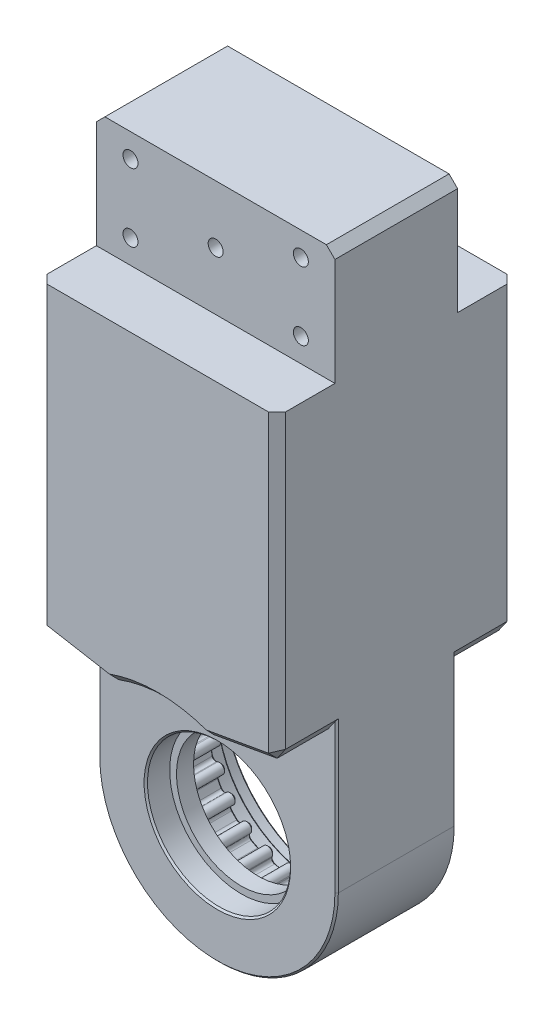
from build123d import *
from OCP.BRepFilletAPI import BRepFilletAPI_MakeChamfer

# Parameters (mm, degrees)
SKIZZE1_W                       = 31.75
SKIZZE1_H                       = 17.5
SCHNITT_LINEAR_AUSTRAGEN1_DEPTH = 49.191026136
VERRUNDUNG1_R                   = 1
AUFSATZ_LINEAR_START            = 12
SKIZZE13_R                      = 31.75
SKIZZE13_R_2                    = 21
AUFSATZ_LINEAR_AUSTRAGEN1_DEPTH = 12
AUFSATZ_LINEAR_START_2          = -5
SKIZZE14_R                      = 21
SKIZZE14_R_2                    = 19
AUFSATZ_LINEAR_AUSTRAGEN2_DEPTH = 5
SKETCH2_R                       = 35
SKETCH2_R_2                     = 32.75
SKETCH2_R_3                     = 31.75
BOSS_EXTRUDE1_DEPTH             = 29.5
BOSS_EXTRUDE2_START             = 5.5
SKETCH2_3_R                     = 35
SKETCH2_3_R_2                   = 32.75
BOSS_EXTRUDE2_DEPTH             = 5.5
BOSS_EXTRUDE3_DEPTH             = 35
BOSS_EXTRUDE4_START             = -52.5
BOSS_EXTRUDE4_DEPTH             = 70
BOSS_EXTRUDE5_DEPTH             = 0.5
BOSS_EXTRUDE5_DEPTH_BACK        = 35.5
SKETCH4_3_W                     = 70
SKETCH4_3_H                     = 34
F_2_5MM_CHAMFER1_SIZE           = 2.5
F_2_5MM_CHAMFER1_SIZE2          = 3.08200763
F_0_5MM_CHAMFER2_SIZE           = 0.5


# Read off the part's stored shape, not the designer's step: Ø4.4 (4.4) Diameter Hole1
with BuildPart() as part:
    # Skizze1 → Rotation1 (revolve)
    with BuildSketch(Plane.XZ, mode=Mode.PRIVATE) as rotation1_sk:
        with Locations((15.875, 1.75)):
            Rectangle(SKIZZE1_W, SKIZZE1_H)
    revolve(rotation1_sk.sketch.rotate(Axis((0, 0, 10.5), (0, 0, -1)), 180), axis=Axis((0, 0, 10.5), (0, 0, -1)))

    # Skizze2 → Schnitt-Linear austragen1 (cut, through all)
    with BuildSketch(Plane.XY.offset(10.5)):
        with BuildLine():
            ThreePointArc((1.5, 22), (0, 20.5), (-1.5, 22))
            Line((-1.5, 22), (-1.5, 23.452078799))
            ThreePointArc((-1.5, 23.452078799), (-3.676209928, 23.210676004), (-5.820506128, 22.767777854))
            Line((-5.820506128, 22.767777854), (-5.371789102, 21.38676885))
            ThreePointArc((-5.371789102, 21.38676885), (-5.316841365, 21.157895056), (-5.298373876, 20.923243358))
            ThreePointArc((-5.298373876, 20.923243358), (-6.563722179, 19.441710848), (-8.224958651, 20.459717867))
            Line((-8.224958651, 20.459717867), (-8.673675677, 21.840726871))
            ThreePointArc((-8.673675677, 21.840726871), (-10.668776744, 20.938653318), (-12.571260562, 19.85480818))
            Line((-12.571260562, 19.85480818), (-11.717750059, 18.680051755))
            ThreePointArc((-11.717750059, 18.680051755), (-11.504690776, 18.261899368), (-11.43127555, 17.798373876))
            ThreePointArc((-11.43127555, 17.798373876), (-12.467750059, 16.371789102), (-14.144801042, 16.916695998))
            Line((-14.144801042, 16.916695998), (-14.998311545, 18.091452423))
            ThreePointArc((-14.998311545, 18.091452423), (-16.617009358, 16.617009358), (-18.091452423, 14.998311545))
            Line((-18.091452423, 14.998311545), (-16.916695998, 14.144801042))
            ThreePointArc((-16.916695998, 14.144801042), (-16.46186409, 13.6122613), (-16.298373876, 12.93127555))
            ThreePointArc((-16.298373876, 12.93127555), (-17.117388127, 11.594765764), (-18.680051755, 11.717750059))
            Line((-18.680051755, 11.717750059), (-19.85480818, 12.571260562))
            ThreePointArc((-19.85480818, 12.571260562), (-20.938653318, 10.668776744), (-21.840726871, 8.673675677))
            Line((-21.840726871, 8.673675677), (-20.459717867, 8.224958651))
            ThreePointArc((-20.459717867, 8.224958651), (-19.709717867, 7.680051755), (-19.423243358, 6.798373876))
            ThreePointArc((-19.423243358, 6.798373876), (-20.04156548, 5.584848385), (-21.38676885, 5.371789102))
            Line((-21.38676885, 5.371789102), (-22.767777854, 5.820506128))
            ThreePointArc((-22.767777854, 5.820506128), (-23.210676004, 3.676209928), (-23.452078799, 1.5))
            Line((-23.452078799, 1.5), (-22, 1.5))
            ThreePointArc((-22, 1.5), (-20.939339828, 1.060660172), (-20.5, 0))
            ThreePointArc((-20.5, 0), (-20.939339828, -1.060660172), (-22, -1.5))
            Line((-22, -1.5), (-23.452078799, -1.5))
            ThreePointArc((-23.452078799, -1.5), (-23.210676004, -3.676209928), (-22.767777854, -5.820506128))
            Line((-22.767777854, -5.820506128), (-21.38676885, -5.371789102))
            ThreePointArc((-21.38676885, -5.371789102), (-20.04156548, -5.584848385), (-19.423243358, -6.798373876))
            ThreePointArc((-19.423243358, -6.798373876), (-19.709717867, -7.680051755), (-20.459717867, -8.224958651))
            Line((-20.459717867, -8.224958651), (-21.840726871, -8.673675677))
            ThreePointArc((-21.840726871, -8.673675677), (-20.938653318, -10.668776744), (-19.85480818, -12.571260562))
            Line((-19.85480818, -12.571260562), (-18.680051755, -11.717750059))
            ThreePointArc((-18.680051755, -11.717750059), (-17.117388127, -11.594765764), (-16.298373876, -12.93127555))
            ThreePointArc((-16.298373876, -12.93127555), (-16.46186409, -13.6122613), (-16.916695998, -14.144801042))
            Line((-16.916695998, -14.144801042), (-18.091452423, -14.998311545))
            ThreePointArc((-18.091452423, -14.998311545), (-16.617009358, -16.617009358), (-14.998311545, -18.091452423))
            Line((-14.998311545, -18.091452423), (-14.144801042, -16.916695998))
            ThreePointArc((-14.144801042, -16.916695998), (-12.467750059, -16.371789102), (-11.43127555, -17.798373876))
            ThreePointArc((-11.43127555, -17.798373876), (-11.504690776, -18.261899368), (-11.717750059, -18.680051755))
            Line((-11.717750059, -18.680051755), (-12.571260562, -19.85480818))
            ThreePointArc((-12.571260562, -19.85480818), (-10.668776744, -20.938653318), (-8.673675677, -21.840726871))
            Line((-8.673675677, -21.840726871), (-8.224958651, -20.459717867))
            ThreePointArc((-8.224958651, -20.459717867), (-6.563722179, -19.441710848), (-5.298373876, -20.923243358))
            ThreePointArc((-5.298373876, -20.923243358), (-5.316841365, -21.157895056), (-5.371789102, -21.38676885))
            Line((-5.371789102, -21.38676885), (-5.820506128, -22.767777854))
            ThreePointArc((-5.820506128, -22.767777854), (-3.676209928, -23.210676004), (-1.5, -23.452078799))
            Line((-1.5, -23.452078799), (-1.5, -22))
            ThreePointArc((-1.5, -22), (0, -20.5), (1.5, -22))
            Line((1.5, -22), (1.5, -23.452078799))
            ThreePointArc((1.5, -23.452078799), (3.676209928, -23.210676004), (5.820506128, -22.767777854))
            Line((5.820506128, -22.767777854), (5.371789102, -21.38676885))
            ThreePointArc((5.371789102, -21.38676885), (6.334848385, -19.496658584), (8.224958651, -20.459717867))
            Line((8.224958651, -20.459717867), (8.673675677, -21.840726871))
            ThreePointArc((8.673675677, -21.840726871), (10.668776744, -20.938653318), (12.571260562, -19.85480818))
            Line((12.571260562, -19.85480818), (11.717750059, -18.680051755))
            ThreePointArc((11.717750059, -18.680051755), (12.049597672, -16.584848385), (14.144801042, -16.916695998))
            Line((14.144801042, -16.916695998), (14.998311545, -18.091452423))
            ThreePointArc((14.998311545, -18.091452423), (16.617009358, -16.617009358), (18.091452423, -14.998311545))
            Line((18.091452423, -14.998311545), (16.916695998, -14.144801042))
            ThreePointArc((16.916695998, -14.144801042), (16.584848385, -12.049597672), (18.680051755, -11.717750059))
            Line((18.680051755, -11.717750059), (19.85480818, -12.571260562))
            ThreePointArc((19.85480818, -12.571260562), (20.938653318, -10.668776744), (21.840726871, -8.673675677))
            Line((21.840726871, -8.673675677), (20.459717867, -8.224958651))
            ThreePointArc((20.459717867, -8.224958651), (19.496658584, -6.334848385), (21.38676885, -5.371789102))
            Line((21.38676885, -5.371789102), (22.767777854, -5.820506128))
            ThreePointArc((22.767777854, -5.820506128), (23.210676004, -3.676209928), (23.452078799, -1.5))
            Line((23.452078799, -1.5), (22, -1.5))
            ThreePointArc((22, -1.5), (20.5, 0), (22, 1.5))
            Line((22, 1.5), (23.452078799, 1.5))
            ThreePointArc((23.452078799, 1.5), (23.210676004, 3.676209928), (22.767777854, 5.820506128))
            Line((22.767777854, 5.820506128), (21.38676885, 5.371789102))
            ThreePointArc((21.38676885, 5.371789102), (19.496658584, 6.334848385), (20.459717867, 8.224958651))
            Line((20.459717867, 8.224958651), (21.840726871, 8.673675677))
            ThreePointArc((21.840726871, 8.673675677), (20.938653318, 10.668776744), (19.85480818, 12.571260562))
            Line((19.85480818, 12.571260562), (18.680051755, 11.717750059))
            ThreePointArc((18.680051755, 11.717750059), (16.584848385, 12.049597672), (16.916695998, 14.144801042))
            Line((16.916695998, 14.144801042), (18.091452423, 14.998311545))
            ThreePointArc((18.091452423, 14.998311545), (16.617009358, 16.617009358), (14.998311545, 18.091452423))
            Line((14.998311545, 18.091452423), (14.144801042, 16.916695998))
            ThreePointArc((14.144801042, 16.916695998), (12.049597672, 16.584848385), (11.717750059, 18.680051755))
            Line((11.717750059, 18.680051755), (12.571260562, 19.85480818))
            ThreePointArc((12.571260562, 19.85480818), (10.668776744, 20.938653318), (8.673675677, 21.840726871))
            Line((8.673675677, 21.840726871), (8.224958651, 20.459717867))
            ThreePointArc((8.224958651, 20.459717867), (6.334848385, 19.496658584), (5.371789102, 21.38676885))
            Line((5.371789102, 21.38676885), (5.820506128, 22.767777854))
            ThreePointArc((5.820506128, 22.767777854), (3.676209928, 23.210676004), (1.5, 23.452078799))
            Line((1.5, 23.452078799), (1.5, 22))
        make_face()
    extrude(amount=-SCHNITT_LINEAR_AUSTRAGEN1_DEPTH, mode=Mode.SUBTRACT)

    # Skizze3 → Schnitt-Rotation1 (revolve, cut)
    with BuildSketch(Plane(origin=(0, 0, 0), x_dir=(1, 0, 0), z_dir=(0, 1, 0))):
        Polygon((29, 7), (0, 7), (0, -0.5), (26.5, -0.5), (27, 0), (29, 0), align=None)
    revolve(axis=Axis((0, 0, -7), (0, 0, 1)), mode=Mode.SUBTRACT)

    # Verrundung1
    verrundung1_edges = [part.edges().sort_by_distance(p)[0] for p in [
        (-8.673675677, 21.840726871, 5.5),
        (-12.571260562, 19.85480818, 5.5),
        (-14.998311545, 18.091452423, 5.5),
        (-18.091452423, 14.998311545, 5.5),
        (-19.85480818, 12.571260562, 5.5),
        (-21.840726871, 8.673675677, 5.5),
        (-22.767777854, 5.820506128, 5.5),
        (-23.452078799, 1.5, 5.5),
        (-23.452078799, -1.5, 5.5),
        (-22.767777854, -5.820506128, 5.5),
        (-21.840726871, -8.673675677, 5.5),
        (-19.85480818, -12.571260562, 5.5),
        (-18.091452423, -14.998311545, 5.5),
        (-14.998311545, -18.091452423, 5.5),
        (-12.571260562, -19.85480818, 5.5),
        (-8.673675677, -21.840726871, 5.5),
        (-5.820506128, -22.767777854, 5.5),
        (-1.5, -23.452078799, 5.5),
        (1.5, -23.452078799, 5.5),
        (5.820506128, -22.767777854, 5.5),
        (8.673675677, -21.840726871, 5.5),
        (12.571260562, -19.85480818, 5.5),
        (14.998311545, -18.091452423, 5.5),
        (18.091452423, -14.998311545, 5.5),
        (19.85480818, -12.571260562, 5.5),
        (21.840726871, -8.673675677, 5.5),
        (22.767777854, -5.820506128, 5.5),
        (23.452078799, -1.5, 5.5),
        (23.452078799, 1.5, 5.5),
        (22.767777854, 5.820506128, 5.5),
        (21.840726871, 8.673675677, 5.5),
        (19.85480818, 12.571260562, 5.5),
        (18.091452423, 14.998311545, 5.5),
        (14.998311545, 18.091452423, 5.5),
        (12.571260562, 19.85480818, 5.5),
        (8.673675677, 21.840726871, 5.5),
        (5.820506128, 22.767777854, 5.5),
        (1.5, 23.452078799, 5.5),
        (-1.5, 23.452078799, 5.5),
        (-5.820506128, 22.767777854, 5.5),
    ]]
    fillet(verrundung1_edges, radius=VERRUNDUNG1_R)

    # Skizze13 → Aufsatz-Linear austragen1 (add)
    with BuildSketch(Plane.XY.offset(10.5).offset(AUFSATZ_LINEAR_START)):
        with Locations(Location((0, 0, 0), (0, 0, 180))):
            Circle(SKIZZE13_R)
        with Locations(Location((0, 0, 0), (0, 0, 182.980613219))):
            Circle(SKIZZE13_R_2, mode=Mode.SUBTRACT)
    extrude(amount=-AUFSATZ_LINEAR_AUSTRAGEN1_DEPTH)

    # Skizze14 → Aufsatz-Linear austragen2 (add)
    with BuildSketch(Plane(origin=(0, 0, 10.5), x_dir=(-1, 0, 0), z_dir=(0, 0, -1)).offset(AUFSATZ_LINEAR_START_2)):
        with Locations(Location((0, 0, 0), (0, 0, 180))):
            Circle(SKIZZE14_R)
        Circle(SKIZZE14_R_2, mode=Mode.SUBTRACT)
    extrude(amount=AUFSATZ_LINEAR_AUSTRAGEN2_DEPTH)

    # Sketch2 → Boss-Extrude1 (add, through all)
    # profile 1 of 2: a face of its own
    with BuildSketch(Plane(origin=(0, 0, -7), x_dir=(-1, 0, 0), z_dir=(0, 0, -1))):
        Circle(SKETCH2_R)
        Circle(SKETCH2_R_2, mode=Mode.SUBTRACT)
    # profile 2 of 2: a face of its own
    with BuildSketch(Plane(origin=(0, 0, -7), x_dir=(-1, 0, 0), z_dir=(0, 0, -1))):
        Circle(SKETCH2_R_2)
        Circle(SKETCH2_R_3, mode=Mode.SUBTRACT)
    extrude(amount=-BOSS_EXTRUDE1_DEPTH)

    # Sketch2<3> → Boss-Extrude2 (add)
    with BuildSketch(Plane(origin=(0, 0, -7), x_dir=(-1, 0, 0), z_dir=(0, 0, -1)).offset(BOSS_EXTRUDE2_START)):
        Circle(SKETCH2_3_R)
        Circle(SKETCH2_3_R_2, mode=Mode.SUBTRACT)
    extrude(amount=-BOSS_EXTRUDE2_DEPTH)

    # Sketch3 → Boss-Extrude3 (add, through all)
    with BuildSketch(Plane(origin=(0, 0, -12.5), x_dir=(-1, 0, 0), z_dir=(0, 0, -1))):
        with BuildLine():
            Line((-35, 164), (-35, 0))
            ThreePointArc((-35, 0), (0, 35), (35, 0))
            Line((35, 0), (35, 164))
            Line((35, 164), (-35, 164))
        make_face()
    extrude(amount=-BOSS_EXTRUDE3_DEPTH)

    # Sketch4 → Boss-Extrude4 (add)
    with BuildSketch(Plane(origin=(0, 0, -12.5), x_dir=(-1, 0, 0), z_dir=(0, 0, -1)).offset(BOSS_EXTRUDE4_START)):
        with BuildLine():
            Line((35, 130), (-35, 130))
            Line((-35, 130), (-35, 41.171444325))
            Line((-35, 41.171444325), (-14.002564118, 37.469029853))
            ThreePointArc((-14.002564118, 37.469029853), (0, 40), (14.002564118, 37.469029853))
            Line((14.002564118, 37.469029853), (35, 41.171444325))
            Line((35, 41.171444325), (35, 130))
        make_face()
    extrude(amount=BOSS_EXTRUDE4_DEPTH)

    # Sketch4<3> → Boss-Extrude5 (add, two sides: drawn at the far end of the back side and taken through both)
    with BuildSketch(Plane(origin=(0, 0, -12.5), x_dir=(-1, 0, 0), z_dir=(0, 0, -1)).offset(-BOSS_EXTRUDE5_DEPTH_BACK)):
        with Locations((0, 147)):
            Rectangle(SKETCH4_3_W, SKETCH4_3_H)
    extrude(amount=BOSS_EXTRUDE5_DEPTH + BOSS_EXTRUDE5_DEPTH_BACK)

    # Ø4.4 (4.4) Diameter Hole1 outline → Ø4.4 (4.4) Diameter Hole1 (revolve, cut)
    with BuildSketch(Plane(origin=(-25, 137, 0), x_dir=(1, 0, 0), z_dir=(0, -1, 0))):
        Polygon((2.2, -7), (0, -5.678106638), (0, -13), (2.2, -13), align=None)
    f_4_4_4_4_diameter_hole1 = revolve(axis=Axis((-25, 137, 0), (0, 0, 1)), mode=Mode.SUBTRACT)

    # 4.4 _4.4_ Diameter Hole1 2 outline → 4.4 _4.4_ Diameter Hole1 2 (revolve, cut)
    with BuildSketch(Plane(origin=(25, 157, 0), x_dir=(1, 0, 0), z_dir=(0, -1, 0))):
        Polygon((2.2, -7), (0, -5.678106638), (0, -13), (2.2, -13), align=None)
    f_4_4_4_4_diameter_hole1_2 = revolve(axis=Axis((25, 157, 0), (0, 0, 1)), mode=Mode.SUBTRACT)

    # 4.4 _4.4_ Diameter Hole1 3 outline → 4.4 _4.4_ Diameter Hole1 3 (revolve, cut)
    with BuildSketch(Plane(origin=(25, 137, 0), x_dir=(1, 0, 0), z_dir=(0, -1, 0))):
        Polygon((2.2, -7), (0, -5.678106638), (0, -13), (2.2, -13), align=None)
    f_4_4_4_4_diameter_hole1_3 = revolve(axis=Axis((25, 137, 0), (0, 0, 1)), mode=Mode.SUBTRACT)

    # 4.4 _4.4_ Diameter Hole1 4 outline → 4.4 _4.4_ Diameter Hole1 4 (revolve, cut)
    with BuildSketch(Plane(origin=(-25, 157, 0), x_dir=(1, 0, 0), z_dir=(0, -1, 0))):
        Polygon((2.2, -7), (0, -5.678106638), (0, -13), (2.2, -13), align=None)
    f_4_4_4_4_diameter_hole1_4 = revolve(axis=Axis((-25, 157, 0), (0, 0, 1)), mode=Mode.SUBTRACT)

    # 4.4 _4.4_ Diameter Hole1 5 outline → 4.4 _4.4_ Diameter Hole1 5 (revolve, cut)
    with BuildSketch(Plane.XZ.offset(-147)):
        Polygon((2.2, -7), (0, -5.678106638), (0, -13), (2.2, -13), align=None)
    f_4_4_4_4_diameter_hole1_5 = revolve(axis=Axis((0, 147, 0), (0, 0, 1)), mode=Mode.SUBTRACT)

    # Mirror1: Ø4.4 (4.4) Diameter Hole1, 4.4 _4.4_ Diameter Hole1 2, 4.4 _4.4_ Diameter Hole1 3, 4.4 _4.4_ Diameter Hole1 4, 4.4 _4.4_ Diameter Hole1 5 across plane
    add(f_4_4_4_4_diameter_hole1.mirror(Plane.XY.offset(5)), mode=Mode.SUBTRACT)
    add(f_4_4_4_4_diameter_hole1_2.mirror(Plane.XY.offset(5)), mode=Mode.SUBTRACT)
    add(f_4_4_4_4_diameter_hole1_3.mirror(Plane.XY.offset(5)), mode=Mode.SUBTRACT)
    add(f_4_4_4_4_diameter_hole1_4.mirror(Plane.XY.offset(5)), mode=Mode.SUBTRACT)
    add(f_4_4_4_4_diameter_hole1_5.mirror(Plane.XY.offset(5)), mode=Mode.SUBTRACT)

    # 2,5mm Chamfer1: one chamfer whose edges measure the first distance from different faces: ONE call of the kernel's chamfer builder (chamfer() names one face for all edges)
    f_2_5mm_chamfer1_edges_1 = [part.edges().sort_by_distance(p)[0] for p in [
        (35, 164, 5),
        (-35, 164, 5),
        (35, 85.585722162, 40),
        (-35, 85.585722162, 40),
        (24.501282059, 39.320237089, 40),
        (0, 40, -30),
        (-24.501282059, 39.320237089, -30),
        (-24.501282059, 39.320237089, 40),
        (0, 40, 40),
        (-35, 85.585722162, -30),
        (35, 85.585722162, -30),
        (24.501282059, 39.320237089, -30),
    ]]
    f_2_5mm_chamfer1_edges_2 = [part.edges().sort_by_distance(p)[0] for p in [
        (35, 41.171444325, 31.25),
    ]]
    f_2_5mm_chamfer1_side_2 = [part.faces().sort_by_distance(p)[0] for p in [
        (24.501282059, 39.320237089, 31.25),
    ]]
    f_2_5mm_chamfer1_edges_3 = [part.edges().sort_by_distance(p)[0] for p in [
        (-35, 41.171444325, 31.25),
        (-35, 41.171444325, -21.25),
    ]]
    f_2_5mm_chamfer1_side_3 = [part.faces().sort_by_distance(p)[0] for p in [
        (-35, 83.503772268, 5),
    ]]
    f_2_5mm_chamfer1_edges_4 = [part.edges().sort_by_distance(p)[0] for p in [
        (35, 41.171444325, -21.25),
    ]]
    f_2_5mm_chamfer1_side_4 = [part.faces().sort_by_distance(p)[0] for p in [
        (24.501282059, 39.320237089, -21.25),
    ]]
    f_2_5mm_chamfer1 = BRepFilletAPI_MakeChamfer(part.part.solid().wrapped)
    for e in f_2_5mm_chamfer1_edges_1:
        f_2_5mm_chamfer1.Add(F_2_5MM_CHAMFER1_SIZE, e.wrapped)
    for e in f_2_5mm_chamfer1_edges_2:
        f_2_5mm_chamfer1.Add(F_2_5MM_CHAMFER1_SIZE, F_2_5MM_CHAMFER1_SIZE2, e.wrapped, f_2_5mm_chamfer1_side_2[0].wrapped)  # the first distance lies on this face
    for e in f_2_5mm_chamfer1_edges_3:
        f_2_5mm_chamfer1.Add(F_2_5MM_CHAMFER1_SIZE, F_2_5MM_CHAMFER1_SIZE2, e.wrapped, f_2_5mm_chamfer1_side_3[0].wrapped)  # the first distance lies on this face
    for e in f_2_5mm_chamfer1_edges_4:
        f_2_5mm_chamfer1.Add(F_2_5MM_CHAMFER1_SIZE, F_2_5MM_CHAMFER1_SIZE2, e.wrapped, f_2_5mm_chamfer1_side_4[0].wrapped)  # the first distance lies on this face
    add(Compound.cast(f_2_5mm_chamfer1.Shape()), mode=Mode.REPLACE)

    # 0,5mm Chamfer2
    f_0_5mm_chamfer2_edges = [part.edges().sort_by_distance(p)[0] for p in [
        (-6.334848385, 19.496658584, 0.5),
        (-12.049597672, 16.584848385, 0.5),
        (-16.584848385, 12.049597672, 0.5),
        (-19.496658584, 6.334848385, 0.5),
        (-20.5, 0, 0.5),
        (-19.496658584, -6.334848385, 0.5),
        (-16.584848385, -12.049597672, 0.5),
        (-12.049597672, -16.584848385, 0.5),
        (-6.334848385, -19.496658584, 0.5),
        (0, -20.5, 0.5),
        (6.334848385, -19.496658584, 0.5),
        (12.049597672, -16.584848385, 0.5),
        (16.584848385, -12.049597672, 0.5),
        (19.496658584, -6.334848385, 0.5),
        (20.5, 0, 0.5),
        (19.496658584, 6.334848385, 0.5),
        (16.584848385, 12.049597672, 0.5),
        (12.049597672, 16.584848385, 0.5),
        (6.334848385, 19.496658584, 0.5),
        (0, 20.5, 0.5),
        (-29, 0, -7),
        (-5.427517192, 21.558282275, 0.5),
        (-3.676209928, 23.210676004, 0.5),
        (1.5, 22.180339887, 0.5),
        (3.676209928, 23.210676004, 0.5),
        (5.427517192, 21.558282275, 0.5),
        (8.280686741, 20.631231292, 0.5),
        (10.668776744, 20.938653318, 0.5),
        (11.823751185, 18.825949788, 0.5),
        (14.250802168, 17.062594032, 0.5),
        (16.617009358, 16.617009358, 0.5),
        (17.062594032, 14.250802168, 0.5),
        (18.825949788, 11.823751185, 0.5),
        (20.938653318, 10.668776744, 0.5),
        (20.631231292, 8.280686741, 0.5),
        (21.558282275, 5.427517192, 0.5),
        (23.210676004, 3.676209928, 0.5),
        (22.180339887, 1.5, 0.5),
        (22.180339887, -1.5, 0.5),
        (23.210676004, -3.676209928, 0.5),
        (21.558282275, -5.427517192, 0.5),
        (20.631231292, -8.280686741, 0.5),
        (20.938653318, -10.668776744, 0.5),
        (18.825949788, -11.823751185, 0.5),
        (17.062594032, -14.250802168, 0.5),
        (16.617009358, -16.617009358, 0.5),
        (14.250802168, -17.062594032, 0.5),
        (11.823751185, -18.825949788, 0.5),
        (10.668776744, -20.938653318, 0.5),
        (8.280686741, -20.631231292, 0.5),
        (5.427517192, -21.558282275, 0.5),
        (3.676209928, -23.210676004, 0.5),
        (1.5, -22.180339887, 0.5),
        (-1.5, -22.180339887, 0.5),
        (-3.676209928, -23.210676004, 0.5),
        (-5.427517192, -21.558282275, 0.5),
        (-8.280686741, -20.631231292, 0.5),
        (-10.668776744, -20.938653318, 0.5),
        (-11.823751185, -18.825949788, 0.5),
        (-14.250802168, -17.062594032, 0.5),
        (-16.617009358, -16.617009358, 0.5),
        (-17.062594032, -14.250802168, 0.5),
        (-18.825949788, -11.823751185, 0.5),
        (-20.938653318, -10.668776744, 0.5),
        (-17.062594032, 14.250802168, 0.5),
        (-16.617009358, 16.617009358, 0.5),
        (-11.823751185, 18.825949788, 0.5),
        (-10.668776744, 20.938653318, 0.5),
        (-1.5, 22.180339887, 0.5),
        (-8.280686741, 20.631231292, 0.5),
        (-14.250802168, 17.062594032, 0.5),
        (-20.631231292, -8.280686741, 0.5),
        (-23.210676004, -3.676209928, 0.5),
        (-22.180339887, -1.5, 0.5),
        (-21.558282275, -5.427517192, 0.5),
        (-22.180339887, 1.5, 0.5),
        (-23.210676004, 3.676209928, 0.5),
        (-20.631231292, 8.280686741, 0.5),
        (-20.938653318, 10.668776744, 0.5),
        (-18.825949788, 11.823751185, 0.5),
        (-21.558282275, 5.427517192, 0.5),
        (-5.396554112, 22.541677039, 0.5),
        (1.833333333, 23.106035767, 0.5),
        (5.396554112, 22.541677039, 0.5),
        (8.883761338, 21.408614726, 0.5),
        (12.09818924, 19.770781904, 0.5),
        (15.064584886, 17.615569313, 0.5),
        (17.615569313, 15.064584886, 0.5),
        (19.770781904, 12.09818924, 0.5),
        (21.408614726, 8.883761338, 0.5),
        (22.541677039, 5.396554112, 0.5),
        (23.106035767, 1.833333333, 0.5),
        (23.106035767, -1.833333333, 0.5),
        (22.541677039, -5.396554112, 0.5),
        (21.408614726, -8.883761338, 0.5),
        (19.770781904, -12.09818924, 0.5),
        (17.615569313, -15.064584886, 0.5),
        (15.064584886, -17.615569313, 0.5),
        (12.09818924, -19.770781904, 0.5),
        (8.883761338, -21.408614726, 0.5),
        (5.396554112, -22.541677039, 0.5),
        (1.833333333, -23.106035767, 0.5),
        (-1.833333333, -23.106035767, 0.5),
        (-5.396554112, -22.541677039, 0.5),
        (-8.883761338, -21.408614726, 0.5),
        (-12.09818924, -19.770781904, 0.5),
        (-15.064584886, -17.615569313, 0.5),
        (-17.615569313, -15.064584886, 0.5),
        (-19.770781904, -12.09818924, 0.5),
        (-17.615569313, 15.064584886, 0.5),
        (-12.09818924, 19.770781904, 0.5),
        (-1.833333333, 23.106035767, 0.5),
        (-8.883761338, 21.408614726, 0.5),
        (-15.064584886, 17.615569313, 0.5),
        (-21.408614726, -8.883761338, 0.5),
        (-23.106035767, -1.833333333, 0.5),
        (-22.541677039, -5.396554112, 0.5),
        (-23.106035767, 1.833333333, 0.5),
        (-21.408614726, 8.883761338, 0.5),
        (-19.770781904, 12.09818924, 0.5),
        (-22.541677039, 5.396554112, 0.5),
        (20.971590909, 1.09195913, 22.5),
        (32.75, 0, -12.5),
        (0, -35, -12.5),
        (0, -35, 22.5),
        (35, 22.126725977, -12.5),
        (-35, 21.835722162, 22.5),
        (35, 22.126725977, 22.5),
        (-35, 21.835722162, -12.5),
    ]]
    chamfer(f_0_5mm_chamfer2_edges, length=F_0_5MM_CHAMFER2_SIZE)


solid = part.part
